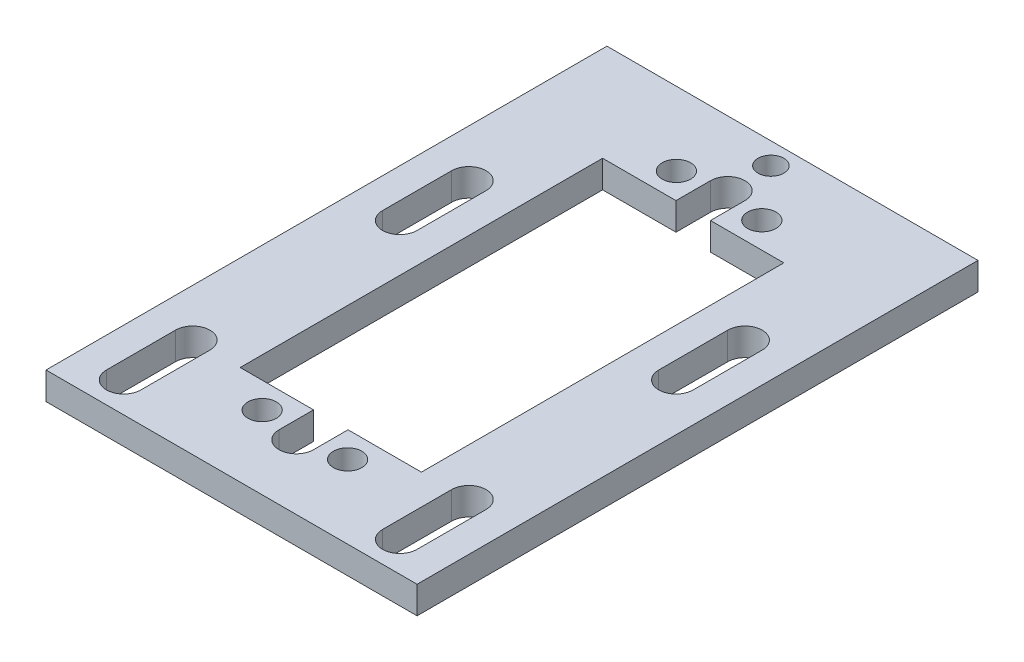
from build123d import *

# Parameters (mm, degrees)
SKETCH1_W           = 43
SKETCH1_H           = 65
SKETCH1_R           = 1.65
BOSS_EXTRUDE1_DEPTH = 3.175
CUT_EXTRUDE1_DEPTH  = 3.175
SKETCH4_R           = 1.5
CUT_EXTRUDE2_DEPTH  = 10


with BuildPart() as part:
    # Sketch1 → Boss-Extrude1 (new body)
    with BuildSketch(Plane(origin=(0, 0, 0), x_dir=(1, 0, 0), z_dir=(0, 1, 0))):
        Rectangle(SKETCH1_W, SKETCH1_H)
        with Locations((-4.95, -24)):
            Circle(SKETCH1_R, mode=Mode.SUBTRACT)
        with BuildLine():
            Line((-10.5, 21), (-2, 21))
            Line((-2, 21), (-2, 24))
            Line((-2, 24), (-2, 25))
            ThreePointArc((-2, 25), (0, 27), (2, 25))
            Line((2, 25), (2, 24))
            Line((2, 24), (2, 21))
            Line((2, 21), (10.5, 21))
            Line((10.5, 21), (10.5, 0))
            Line((10.5, 0), (10.5, -21))
            Line((10.5, -21), (2, -21))
            Line((2, -21), (2, -24))
            Line((2, -24), (2, -25))
            ThreePointArc((2, -25), (0, -27), (-2, -25))
            Line((-2, -25), (-2, -24))
            Line((-2, -24), (-2, -21))
            Line((-2, -21), (-10.5, -21))
            Line((-10.5, -21), (-10.5, 0))
            Line((-10.5, 0), (-10.5, 21))
        make_face(mode=Mode.SUBTRACT)
        with BuildLine():
            ThreePointArc((6.6, -24), (4.95, -25.65), (3.3, -24))
            ThreePointArc((3.3, -24), (4.95, -22.35), (6.6, -24))
        make_face(mode=Mode.SUBTRACT)
        with Locations((-4.95, 24)):
            Circle(SKETCH1_R, mode=Mode.SUBTRACT)
        with BuildLine():
            ThreePointArc((6.6, 24), (4.95, 22.35), (3.3, 24))
            ThreePointArc((3.3, 24), (4.95, 25.65), (6.6, 24))
        make_face(mode=Mode.SUBTRACT)
    extrude(amount=BOSS_EXTRUDE1_DEPTH)

    # Sketch3 → Cut-Extrude1 (cut)
    with BuildSketch(Plane(origin=(0, 3.175, 0), x_dir=(1, 0, 0), z_dir=(0, 1, 0))):
        with BuildLine():
            Line((14, -21), (14, -25))
            Line((14, -25), (14, -29))
            ThreePointArc((14, -29), (16, -31), (18, -29))
            Line((18, -29), (18, -21))
            ThreePointArc((18, -21), (16, -19), (14, -21))
        make_face()
        with BuildLine():
            Line((-14, -29), (-14, -25))
            Line((-14, -25), (-14, -21))
            ThreePointArc((-14, -21), (-16, -19), (-18, -21))
            Line((-18, -21), (-18, -29))
            ThreePointArc((-18, -29), (-16, -31), (-14, -29))
        make_face()
        with BuildLine():
            Line((-14, 3), (-14, 11))
            ThreePointArc((-14, 11), (-16, 13), (-18, 11))
            Line((-18, 11), (-18, 3))
            ThreePointArc((-18, 3), (-16, 1), (-14, 3))
        make_face()
        with BuildLine():
            ThreePointArc((18, 11), (16, 13), (14, 11))
            Line((14, 11), (14, 3))
            ThreePointArc((14, 3), (16, 1), (18, 3))
            Line((18, 3), (18, 11))
        make_face()
    extrude(amount=-CUT_EXTRUDE1_DEPTH, mode=Mode.SUBTRACT)

    # Sketch4 → Cut-Extrude2 (cut)
    with BuildSketch(Plane(origin=(0, 3.175, 0), x_dir=(1, 0, 0), z_dir=(0, 1, 0))):
        with Locations((0, 30)):
            Circle(SKETCH4_R)
    extrude(amount=-CUT_EXTRUDE2_DEPTH, mode=Mode.SUBTRACT)


solid = part.part
